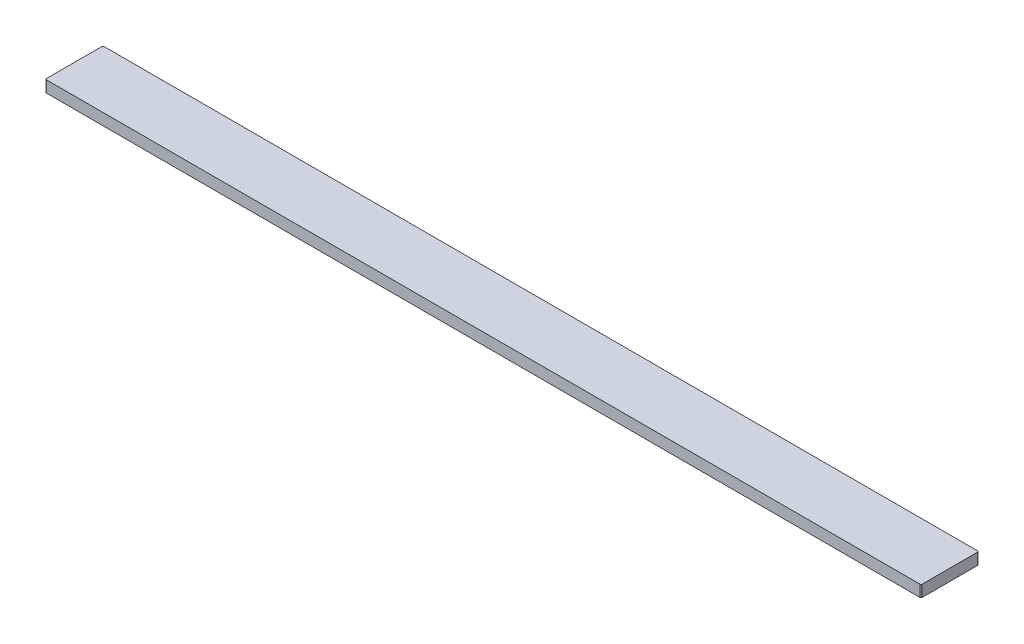
from build123d import *

# Parameters (mm, degrees)
SKETCH1_W          = 760
SKETCH1_H          = 50
BASE_FLANGE1_DEPTH = 10
FILLET_1_0_R       = 1


# Sheet-metal steps are written as plain solids
with BuildPart() as part:
    # Sketch1 → Base-Flange1 (new body)
    with BuildSketch(Plane(origin=(0, 0, 0), x_dir=(1, 0, 0), z_dir=(0, 1, 0))):
        with Locations((0, 25)):
            Rectangle(SKETCH1_W, SKETCH1_H)
    extrude(amount=-BASE_FLANGE1_DEPTH)

    # Fillet-1.0
    fillet_1_0_edges = [part.edges().sort_by_distance(p)[0] for p in [
        (-380, -5, -50),
        (380, -5, -50),
        (380, -5, 0),
        (-380, -5, 0),
    ]]
    fillet(fillet_1_0_edges, radius=FILLET_1_0_R)


solid = part.part
